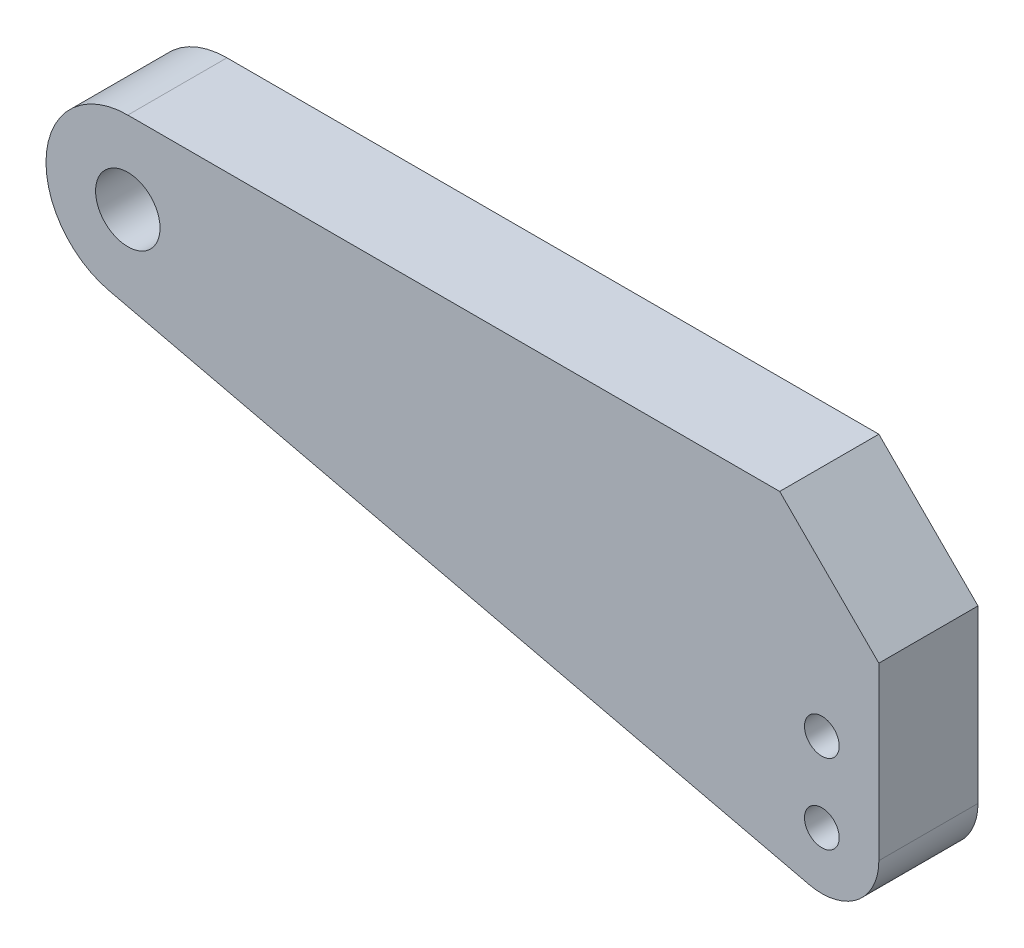
from build123d import *

# Parameters (mm, degrees)
SKETCH1_R           = 3.25
SKETCH1_R_2         = 1.75
BOSS_EXTRUDE1_DEPTH = 10


with BuildPart() as part:
    # Sketch1 → Boss-Extrude1 (new body)
    with BuildSketch(Plane.XY):
        with BuildLine():
            Line((65.75, 8.25), (0, 8.25))
            ThreePointArc((0, 8.25), (-8.195237388, 0.948991121), (-1.88538364, -8.03167657))
            Line((-1.88538364, -8.03167657), (68.685944735, -24.597835185))
            ThreePointArc((68.685944735, -24.597835185), (73.571182033, -23.506568416), (75.75, -19))
            Line((75.75, -19), (75.75, -1.75))
            Line((75.75, -1.75), (65.75, 8.25))
        make_face()
        Circle(SKETCH1_R, mode=Mode.SUBTRACT)
        with Locations((70, -11)):
            Circle(SKETCH1_R_2, mode=Mode.SUBTRACT)
        with Locations((70, -19)):
            Circle(SKETCH1_R_2, mode=Mode.SUBTRACT)
    extrude(amount=BOSS_EXTRUDE1_DEPTH)


solid = part.part
